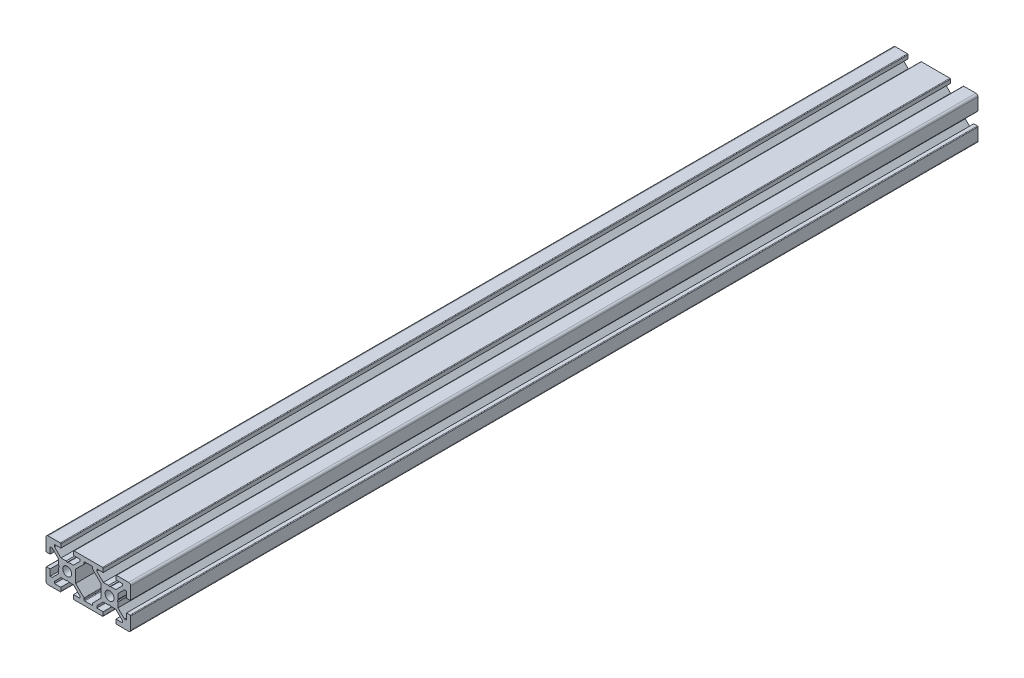
from build123d import *

# Parameters (mm, degrees)
SKETCH1_R           = 2.0999999
BOSS_EXTRUDE2_DEPTH = 400


# Read off the part's stored shape, not the designer's step: Imported1
with BuildPart() as part:
    # Sketch1 → Boss-Extrude2 (new body)
    with BuildSketch(Plane.XY.offset(10)):
        with BuildLine():
            Line((15.999999496, 12), (12.9999995, 12))
            Line((12.9999995, 12), (12.9999995, 10.3))
            ThreePointArc((12.9999995, 10.3), (13.087867466, 10.087867966), (13.2999995, 10))
            Line((13.2999995, 10), (26.7, 10))
            ThreePointArc((26.7, 10), (26.912132034, 10.087867966), (27, 10.3))
            Line((27, 10.3), (27, 12))
            Line((27, 12), (24, 12))
            Line((24, 12), (24, 12.9393436))
            Line((24, 12.9393436), (27.06068075, 16))
            Line((27.06068075, 16), (29.480384758, 16))
            Line((29.480384758, 16), (30, 16.3))
            Line((30, 16.3), (30.519615242, 16))
            Line((30.519615242, 16), (32.93933675, 16))
            Line((32.93933675, 16), (36, 12.9393398))
            Line((36, 12.9393398), (36, 12))
            Line((36, 12), (33, 12))
            Line((33, 12), (33, 10.3))
            ThreePointArc((33, 10.3), (33.087867966, 10.087867966), (33.3, 10))
            Line((33.3, 10), (39, 10))
            ThreePointArc((39, 10), (39.707106781, 10.292893219), (40, 11))
            Line((40, 11), (40, 16.7))
            ThreePointArc((40, 16.7), (39.912132034, 16.912132034), (39.7, 17))
            Line((39.7, 17), (38, 17))
            Line((38, 17), (38, 14))
            Line((38, 14), (37.0606655, 13.99999425))
            Line((37.0606655, 13.99999425), (34, 17.060646))
            Line((34, 17.060646), (34, 19.480361375))
            Line((34, 19.480361375), (33.6999865, 20))
            Line((33.6999865, 20), (33.9999865, 20.519615242))
            Line((33.9999865, 20.519615242), (33.9999865, 22.9393395))
            Line((33.9999865, 22.9393395), (37.060675, 25.999997))
            Line((37.060675, 25.999997), (38, 25.999997))
            Line((38, 25.999997), (38, 23))
            Line((38, 23), (39.7, 23))
            ThreePointArc((39.7, 23), (39.912132034, 23.087867966), (40, 23.3))
            Line((40, 23.3), (40, 29))
            ThreePointArc((40, 29), (39.707106781, 29.707106781), (39, 30))
            Line((39, 30), (33.3, 30))
            ThreePointArc((33.3, 30), (33.087867966, 29.912132034), (33, 29.7))
            Line((33, 29.7), (33, 28))
            Line((33, 28), (36, 28))
            Line((36, 28), (36, 27.0606575))
            Line((36, 27.0606575), (32.9393565, 24))
            Line((32.9393565, 24), (30.519615242, 24))
            Line((30.519615242, 24), (30, 23.7))
            Line((30, 23.7), (29.480384758, 24))
            Line((29.480384758, 24), (27.06066, 24))
            Line((27.06066, 24), (24.0000025, 27.0606565))
            Line((24.0000025, 27.0606565), (24.0000025, 28))
            Line((24.0000025, 28), (27, 28))
            Line((27, 28), (27, 29.7))
            ThreePointArc((27, 29.7), (26.912132034, 29.912132034), (26.7, 30))
            Line((26.7, 30), (13.2999995, 30))
            ThreePointArc((13.2999995, 30), (13.087867466, 29.912132034), (12.9999995, 29.7))
            Line((12.9999995, 29.7), (12.9999995, 28))
            Line((12.9999995, 28), (15.9999995, 28))
            Line((15.9999995, 28), (15.9999995, 27.06066257))
            Line((15.9999995, 27.06066257), (12.9393312, 24))
            Line((12.9393312, 24), (10.519614742, 24))
            Line((10.519614742, 24), (9.9999995, 23.7))
            Line((9.9999995, 23.7), (9.480384258, 24))
            Line((9.480384258, 24), (7.0606425, 24))
            Line((7.0606425, 24), (3.9999995, 27.0606365))
            Line((3.9999995, 27.0606365), (3.9999995, 28))
            Line((3.9999995, 28), (6.9999995, 28))
            Line((6.9999995, 28), (6.9999995, 29.7))
            ThreePointArc((6.9999995, 29.7), (6.912131534, 29.912132034), (6.6999995, 30))
            Line((6.6999995, 30), (1, 30))
            ThreePointArc((1, 30), (0.292893219, 29.707106781), (0, 29))
            Line((0, 29), (0, 23.3))
            ThreePointArc((0, 23.3), (0.087867966, 23.087867966), (0.3, 23))
            Line((0.3, 23), (2, 23))
            Line((2, 23), (2, 25.999998))
            Line((2, 25.999998), (2.9393195, 25.999998))
            Line((2.9393195, 25.999998), (6, 22.939318))
            Line((6, 22.939318), (6, 20.519615242))
            Line((6, 20.519615242), (6.3, 20))
            Line((6.3, 20), (6, 19.480384758))
            Line((6, 19.480384758), (6, 17.0606635))
            Line((6, 17.0606635), (2.9393372, 14))
            Line((2.9393372, 14), (2, 14))
            Line((2, 14), (2, 17))
            Line((2, 17), (0.3, 17))
            ThreePointArc((0.3, 17), (0.087867966, 16.912132034), (0, 16.7))
            Line((0, 16.7), (0, 11))
            ThreePointArc((0, 11), (0.292893219, 10.292893219), (1, 10))
            Line((1, 10), (6.6999995, 10))
            ThreePointArc((6.6999995, 10), (6.912131534, 10.087867966), (6.9999995, 10.3))
            Line((6.9999995, 10.3), (6.9999995, 12))
            Line((6.9999995, 12), (3.999991, 12))
            Line((3.999991, 12), (3.999991, 12.93933465))
            Line((3.999991, 12.93933465), (7.0606385, 16))
            Line((7.0606385, 16), (9.480384258, 16))
            Line((9.480384258, 16), (9.9999995, 16.3))
            Line((9.9999995, 16.3), (10.519614742, 16))
            Line((10.519614742, 16), (12.93931635, 16))
            Line((12.93931635, 16), (15.999999496, 12.9393436))
            Line((15.999999496, 12.9393436), (15.999999496, 12))
        make_face()
        with Locations(Location((9.9999995, 20, 0), (0, 0, 180))):
            Circle(SKETCH1_R, mode=Mode.SUBTRACT)
        with Locations(Location((30, 20, 0), (0, 0, 180))):
            Circle(SKETCH1_R, mode=Mode.SUBTRACT)
        with BuildLine():
            Line((17.99999975, 12.936400074), (17.99999975, 12.3))
            ThreePointArc((17.99999975, 12.3), (18.087867716, 12.087867966), (18.29999975, 12))
            Line((18.29999975, 12), (21.6999995, 12))
            ThreePointArc((21.6999995, 12), (21.912131534, 12.087867966), (21.9999995, 12.3))
            Line((21.9999995, 12.3), (21.9999995, 12.936400498))
            ThreePointArc((21.9999995, 12.936400498), (22.022835631, 13.051205559), (22.087867469, 13.148532591))
            Line((22.087867469, 13.148532591), (26, 17.0606645))
            Line((26, 17.0606645), (26, 22.939339))
            Line((26, 22.939339), (22.087867469, 26.851468459))
            ThreePointArc((22.087867469, 26.851468459), (22.022835646, 26.948794955), (21.9999995, 27.063599552))
            Line((21.9999995, 27.063599552), (21.9999995, 27.7))
            ThreePointArc((21.9999995, 27.7), (21.912131534, 27.912132034), (21.6999995, 28))
            Line((21.6999995, 28), (18.29999975, 28))
            ThreePointArc((18.29999975, 28), (18.087867716, 27.912132034), (17.99999975, 27.7))
            Line((17.99999975, 27.7), (17.99999975, 27.063604538))
            ThreePointArc((17.99999975, 27.063604538), (17.977163602, 26.948799949), (17.912131781, 26.851473459))
            Line((17.912131781, 26.851473459), (14, 22.939335))
            Line((14, 22.939335), (14, 17.06066805))
            Line((14, 17.06066805), (17.912135369, 13.14852345))
            ThreePointArc((17.912135369, 13.14852345), (17.977164541, 13.051200418), (17.99999975, 12.936400074))
        make_face(mode=Mode.SUBTRACT)
    extrude(amount=-BOSS_EXTRUDE2_DEPTH)


solid = part.part
